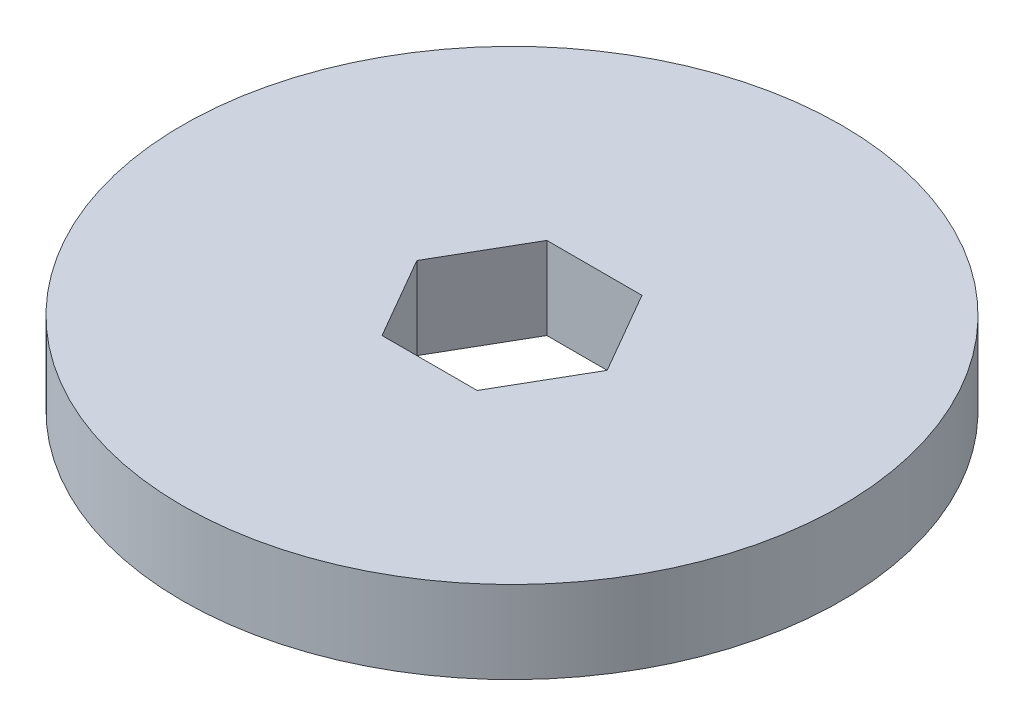
from build123d import *

# Parameters (mm, degrees)
SKETCH1_R           = 25.4
BOSS_EXTRUDE1_DEPTH = 6.35


with BuildPart() as part:
    # Sketch1 → Boss-Extrude1 (new body)
    with BuildSketch(Plane(origin=(0, 0, 0), x_dir=(1, 0, 0), z_dir=(0, 1, 0))):
        Circle(SKETCH1_R)
        Polygon((7.332348419, 0), (3.666174209, 6.35), (-3.666174209, 6.35), (-7.332348419, 0), (-3.666174209, -6.35), (3.666174209, -6.35), align=None, mode=Mode.SUBTRACT)
    extrude(amount=BOSS_EXTRUDE1_DEPTH)


solid = part.part
